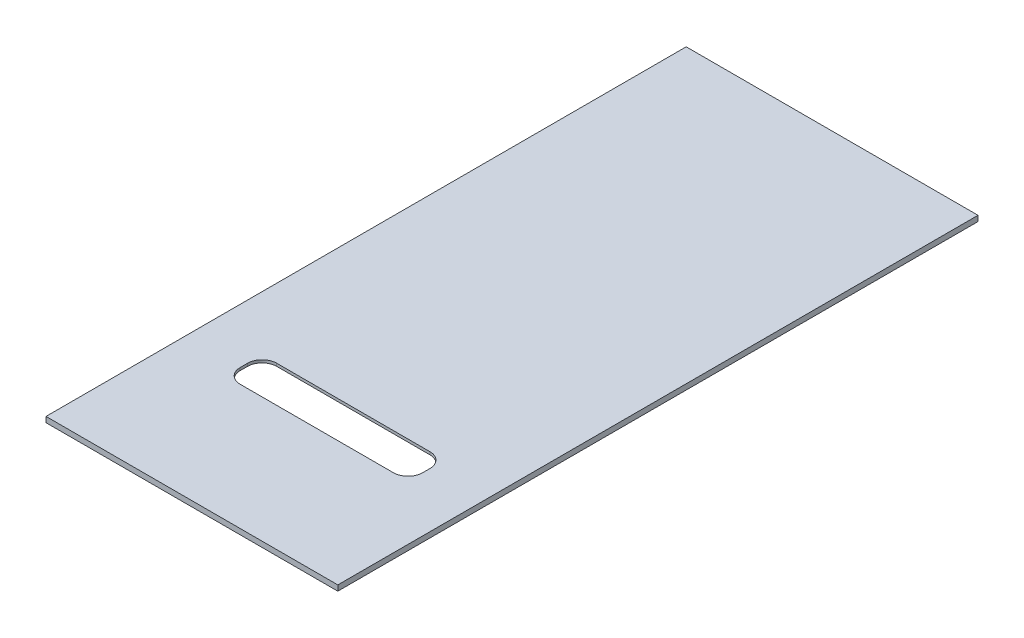
from build123d import *

# Parameters (mm, degrees)
EXTRUDE_1_DEPTH          = 140
EXTRUDE_1_DEPTH_BACK     = 140
EXTRUDE_3_DEPTH          = 35.5
CUT_EXTRUDE_2_REACH      = 197.473
SKETCH_6_W               = 150
SKETCH_6_H               = 80
CUT_EXTRUDE_4_DEPTH      = 6
EXTRUDE_4_DEPTH          = 60.5
CUT_EXTRUDE_START        = -59
CUT_EXTRUDE_6_DEPTH      = 55
CUT_EXTRUDE_START_2      = -4
CUT_EXTRUDE_7_DEPTH      = 27
CUT_EXTRUDE_8_DEPTH      = 35.5
CUT_EXTRUDE_START_3      = -35.5
CUT_EXTRUDE_9_DEPTH      = 35.5
EXTRUDE_5_REACH          = 300.939
SKETCH_25_W              = 121
SKETCH_25_H              = 10
EXTRUDE_6_DEPTH          = 21.5
SKETCH_27_W              = 121
SKETCH_27_H              = 52.5
EXTRUDE_7_DEPTH          = 1.5
SKETCH_28_W              = 121
SKETCH_28_H              = 2
EXTRUDE_8_DEPTH          = 10
CUT_EXTRUDE_11_REACH     = 346.114
SKETCH_29_R              = 2
PATTERN_CIRCULAR_2_COUNT = 10
CUT_EXTRUDE_12_REACH     = 346.114
SKETCH_30_R              = 2
PATTERN_CIRCULAR_3_COUNT = 10
MIRROR_START             = -140
MIRROR_10_OUTLINE_R      = 2
MIRROR_10_DEPTH          = 280
MIRROR_10_2_OUTLINE_R    = 2
MIRROR_10_2_DEPTH        = 4
MIRROR_START_2           = 136
MIRROR_10_3_OUTLINE_R    = 2
MIRROR_10_3_DEPTH        = 4
EXTRUDE_9_REACH          = 263.648
SKETCH_31_W              = 21
SKETCH_31_H              = 16.5
EXTRUDE_10_REACH         = 292.975
SKETCH_34_W              = 121
SKETCH_34_H              = 154
EXTRUDE_11_DEPTH         = 5
EXTRUDE_12_REACH         = 378.928
SKETCH_36_W              = 121
SKETCH_36_H              = 3
EXTRUDE_13_REACH         = 378.928
SKETCH_37_W              = 121
SKETCH_37_H              = 3
SKETCH_38_W              = 100
SKETCH_38_H              = 20
CUT_EXTRUDE_13_DEPTH     = 10
FILLET_1_R               = 8
SKETCH_40_W              = 344.103621996
SKETCH_40_H              = 61.572842363
SKETCH_40_W_2            = 92.051810998
SKETCH_40_H_2            = 3
CUT_EXTRUDE_16_DEPTH     = 399


# Read off the part's stored shape, not the designer's step: 镜向10
with BuildPart() as part:
    # 草图2 → 凸台-拉伸1 (new, two sides: drawn at the far end of the back side and taken through both)
    with BuildSketch(Plane.XY.offset(-EXTRUDE_1_DEPTH_BACK)):
        with BuildLine():
            Line((60.5, 57), (80, 57))
            add(Edge.make_bspline(
                [(80, 57), (110.715171184, 57), (118.023084898, 36.99301361), (125, 20.498008369), (125, 0)],
                knots=[0, 0, 0, 0, 0, 1, 1, 1, 1, 1], degree=4))
            add(Edge.make_bspline(
                [(80, -57), (110.715171184, -57), (118.023084898, -36.99301361), (125, -20.498008369), (125, 0)],
                knots=[0, 0, 0, 0, 0, 1, 1, 1, 1, 1], degree=4))
            Line((80, -57), (60.5, -57))
            Line((60.5, -57), (60.5, -35.5))
            ThreePointArc((60.5, -35.5), (96, 0), (60.5, 35.5))
            Line((60.5, 35.5), (60.5, 57))
        make_face()
    extrude(amount=EXTRUDE_1_DEPTH + EXTRUDE_1_DEPTH_BACK)

    # 草图5 → 凸台-拉伸3 (add)
    with BuildSketch(Plane.XY.offset(140)):
        with BuildLine():
            Line((60.5, -50), (60.5, -57))
            Line((60.5, -57), (80, -57))
            add(Edge.make_bspline(
                [(80, -57), (110.715171184, -57), (118.023084898, -36.99301361), (125, -20.498008369), (125, 0)],
                knots=[0, 0, 0, 0, 0, 1, 1, 1, 1, 1], degree=4))
            add(Edge.make_bspline(
                [(125, 0), (125, 20.498008369), (118.023084898, 36.99301361), (110.715171184, 57), (80, 57)],
                knots=[0, 0, 0, 0, 0, 1, 1, 1, 1, 1], degree=4))
            Line((80, 57), (60.5, 57))
            Line((60.5, 57), (60.5, 50))
            ThreePointArc((60.5, 50), (110.5, 0), (60.5, -50))
        make_face()
    extrude_3 = extrude(amount=EXTRUDE_3_DEPTH)

    # 镜向2: 凸台-拉伸3 across plane
    add(extrude_3.mirror(Plane.XY))

    # 草图6 → 切除-拉伸2 (cut, up to next)
    with BuildSketch(Plane.ZY.offset(-60.5), mode=Mode.PRIVATE) as cut_extrude_2_sk1:
        with Locations((-15, 0)):
            Rectangle(SKETCH_6_W, SKETCH_6_H)
    cut_extrude_2_tool1 = extrude(cut_extrude_2_sk1.sketch, amount=-CUT_EXTRUDE_2_REACH, mode=Mode.PRIVATE) & part.part
    add(cut_extrude_2_tool1.solids().sort_by_distance((60.5, 0, -15))[0], mode=Mode.SUBTRACT)

    # 草图9 → 切除-拉伸4 (cut, symmetric)
    with BuildSketch(Plane(origin=(0, 0, 0), x_dir=(1, 0, 0), z_dir=(0, 1, 0))):
        Polygon((113.429186382, -60), (119.929186382, -60), (119.929186382, -75), (116.929186382, -75), (111.929186382, -69.041232037), (113.429186382, -67.541232037), align=None)
    cut_extrude_4 = extrude(amount=CUT_EXTRUDE_4_DEPTH, both=True, mode=Mode.SUBTRACT)

    # 镜向3: 切除-拉伸4 across plane
    add(cut_extrude_4.mirror(Plane(origin=(0, 0, -15), x_dir=(1, 0, 0), z_dir=(0, 0, -1))), mode=Mode.SUBTRACT)

    # 草图10 → 凸台-拉伸4 (add)
    with BuildSketch(Plane.ZY.offset(-60.5)):
        Polygon((-90, 40), (-90, 35.5), (-92, 35.5), (-92, 42), (62, 42), (62, 35.5), (60, 35.5), (60, 40), align=None)
    extrude(amount=EXTRUDE_4_DEPTH)

    # 草图18 → 切除-拉伸6 (cut)
    with BuildSketch(Plane.XY.offset(140).offset(CUT_EXTRUDE_START)):
        with BuildLine():
            Line((60.5, 54), (60.5, 35.5))
            ThreePointArc((60.5, 35.5), (96, 0), (60.5, -35.5))
            Line((60.5, -35.5), (60.5, -54))
            Line((60.5, -54), (80, -54))
            add(Edge.make_bspline(
                [(80, -54), (84.874930894, -54), (88.983824843, -53.408674679), (94.293485921, -51.914645093), (95.921328006, -51.314644751), (98.940749379, -49.944603182), (100.332473442, -49.174486853), (102.921509382, -47.489185635), (104.118858715, -46.573864409), (106.351651802, -44.617586852), (107.387031345, -43.57654345), (110.285874468, -40.291394559), (111.943828956, -37.885646851), (114.834227827, -32.778060673), (116.065931681, -30.077252128), (118.174928997, -24.486846885), (119.052306998, -21.597764181), (120.481395372, -15.683640995), (121.033233096, -12.658872533), (121.792444122, -6.461288023), (122, -3.288695832), (122, 0)],
                knots=[0, 0, 0, 0, 0.125, 0.125, 0.1875, 0.1875, 0.25, 0.25, 0.3125, 0.3125, 0.375, 0.375, 0.5, 0.5, 0.625, 0.625, 0.75, 0.75, 0.875, 0.875, 1, 1, 1, 1], degree=3))
            add(Edge.make_bspline(
                [(122, 0), (122, 3.288695832), (121.792444122, 6.461288023), (121.033233096, 12.658872533), (120.481395372, 15.683640995), (119.052306998, 21.597764181), (118.174928997, 24.486846885), (116.065931681, 30.077252128), (114.834227827, 32.778060673), (111.943828956, 37.885646851), (110.285874468, 40.291394559), (107.387031345, 43.57654345), (106.351651802, 44.617586852), (104.118858715, 46.573864409), (102.921509382, 47.489185635), (100.332473442, 49.174486853), (98.940749379, 49.944603182), (95.921328006, 51.314644751), (94.293485921, 51.914645093), (88.983824843, 53.408674679), (84.874930894, 54), (80, 54)],
                knots=[0, 0, 0, 0, 0.125, 0.125, 0.25, 0.25, 0.375, 0.375, 0.5, 0.5, 0.625, 0.625, 0.6875, 0.6875, 0.75, 0.75, 0.8125, 0.8125, 0.875, 0.875, 1, 1, 1, 1], degree=3))
            Line((80, 54), (60.5, 54))
        make_face()
    extrude(amount=CUT_EXTRUDE_6_DEPTH, mode=Mode.SUBTRACT)

    # 草图19 → 切除-拉伸7 (cut)
    with BuildSketch(Plane(origin=(0, 0, -140), x_dir=(-1, 0, 0), z_dir=(0, 0, -1)).offset(CUT_EXTRUDE_START_2)):
        with BuildLine():
            Line((-60.5, 54), (-60.5, 35.5))
            ThreePointArc((-60.5, 35.5), (-96, 0), (-60.5, -35.5))
            Line((-60.5, -35.5), (-60.5, -54))
            Line((-60.5, -54), (-80, -54))
            add(Edge.make_bspline(
                [(-80, -54), (-84.874930894, -54), (-88.983824843, -53.408674679), (-94.293485921, -51.914645093), (-95.921328006, -51.314644751), (-98.940749379, -49.944603182), (-100.332473442, -49.174486853), (-102.921509382, -47.489185635), (-104.118858715, -46.573864409), (-106.351651802, -44.617586852), (-107.387031345, -43.57654345), (-110.285874468, -40.291394559), (-111.943828956, -37.885646851), (-114.834227827, -32.778060673), (-116.065931681, -30.077252128), (-118.174928997, -24.486846885), (-119.052306998, -21.597764181), (-120.481395372, -15.683640995), (-121.033233096, -12.658872533), (-121.792444122, -6.461288023), (-122, -3.288695832), (-122, 0)],
                knots=[0, 0, 0, 0, 0.125, 0.125, 0.1875, 0.1875, 0.25, 0.25, 0.3125, 0.3125, 0.375, 0.375, 0.5, 0.5, 0.625, 0.625, 0.75, 0.75, 0.875, 0.875, 1, 1, 1, 1], degree=3))
            add(Edge.make_bspline(
                [(-122, 0), (-122, 3.288695832), (-121.792444122, 6.461288023), (-121.033233096, 12.658872533), (-120.481395372, 15.683640995), (-119.052306998, 21.597764181), (-118.174928997, 24.486846885), (-116.065931681, 30.077252128), (-114.834227827, 32.778060673), (-111.943828956, 37.885646851), (-110.285874468, 40.291394559), (-107.387031345, 43.57654345), (-106.351651802, 44.617586852), (-104.118858715, 46.573864409), (-102.921509382, 47.489185635), (-100.332473442, 49.174486853), (-98.940749379, 49.944603182), (-95.921328006, 51.314644751), (-94.293485921, 51.914645093), (-88.983824843, 53.408674679), (-84.874930894, 54), (-80, 54)],
                knots=[0, 0, 0, 0, 0.125, 0.125, 0.25, 0.25, 0.375, 0.375, 0.5, 0.5, 0.625, 0.625, 0.6875, 0.6875, 0.75, 0.75, 0.8125, 0.8125, 0.875, 0.875, 1, 1, 1, 1], degree=3))
            Line((-80, 54), (-60.5, 54))
        make_face()
    extrude(amount=-CUT_EXTRUDE_7_DEPTH, mode=Mode.SUBTRACT)

    # 草图20 → 切除-拉伸8 (cut)
    with BuildSketch(Plane.XY.offset(175.5)):
        with BuildLine():
            Line((60.5, 54), (60.5, 50))
            ThreePointArc((60.5, 50), (110.5, 0), (60.5, -50))
            Line((60.5, -50), (60.5, -54))
            Line((60.5, -54), (80, -54))
            add(Edge.make_bspline(
                [(80, -54), (84.874930894, -54), (88.983824843, -53.408674679), (94.293485921, -51.914645093), (95.921328006, -51.314644751), (98.940749379, -49.944603182), (100.332473442, -49.174486853), (102.921509382, -47.489185635), (104.118858715, -46.573864409), (106.351651802, -44.617586852), (107.387031345, -43.57654345), (110.285874468, -40.291394559), (111.943828956, -37.885646851), (114.834227827, -32.778060673), (116.065931681, -30.077252128), (118.174928997, -24.486846885), (119.052306998, -21.597764181), (120.481395372, -15.683640995), (121.033233096, -12.658872533), (121.792444122, -6.461288023), (122, -3.288695832), (122, 0)],
                knots=[0, 0, 0, 0, 0.125, 0.125, 0.1875, 0.1875, 0.25, 0.25, 0.3125, 0.3125, 0.375, 0.375, 0.5, 0.5, 0.625, 0.625, 0.75, 0.75, 0.875, 0.875, 1, 1, 1, 1], degree=3))
            add(Edge.make_bspline(
                [(122, 0), (122, 3.288695832), (121.792444122, 6.461288023), (121.033233096, 12.658872533), (120.481395372, 15.683640995), (119.052306998, 21.597764181), (118.174928997, 24.486846885), (116.065931681, 30.077252128), (114.834227827, 32.778060673), (111.943828956, 37.885646851), (110.285874468, 40.291394559), (107.387031345, 43.57654345), (106.351651802, 44.617586852), (104.118858715, 46.573864409), (102.921509382, 47.489185635), (100.332473442, 49.174486853), (98.940749379, 49.944603182), (95.921328006, 51.314644751), (94.293485921, 51.914645093), (88.983824843, 53.408674679), (84.874930894, 54), (80, 54)],
                knots=[0, 0, 0, 0, 0.125, 0.125, 0.25, 0.25, 0.375, 0.375, 0.5, 0.5, 0.625, 0.625, 0.6875, 0.6875, 0.75, 0.75, 0.8125, 0.8125, 0.875, 0.875, 1, 1, 1, 1], degree=3))
            Line((80, 54), (60.5, 54))
        make_face()
    extrude(amount=-CUT_EXTRUDE_8_DEPTH, mode=Mode.SUBTRACT)

    # 草图21 → 切除-拉伸9 (cut)
    with BuildSketch(Plane(origin=(0, 0, -175.5), x_dir=(-1, 0, 0), z_dir=(0, 0, -1)).offset(CUT_EXTRUDE_START_3)):
        with BuildLine():
            Line((-60.5, -50), (-60.5, -54))
            Line((-60.5, -54), (-80, -54))
            add(Edge.make_bspline(
                [(-80, -54), (-84.874930894, -54), (-88.983824843, -53.408674679), (-94.293485921, -51.914645093), (-95.921328006, -51.314644751), (-98.940749379, -49.944603182), (-100.332473442, -49.174486853), (-102.921509382, -47.489185635), (-104.118858715, -46.573864409), (-106.351651802, -44.617586852), (-107.387031345, -43.57654345), (-110.285874468, -40.291394559), (-111.943828956, -37.885646851), (-114.834227827, -32.778060673), (-116.065931681, -30.077252128), (-118.174928997, -24.486846885), (-119.052306998, -21.597764181), (-120.481395372, -15.683640995), (-121.033233096, -12.658872533), (-121.792444122, -6.461288023), (-122, -3.288695832), (-122, 0)],
                knots=[0, 0, 0, 0, 0.125, 0.125, 0.1875, 0.1875, 0.25, 0.25, 0.3125, 0.3125, 0.375, 0.375, 0.5, 0.5, 0.625, 0.625, 0.75, 0.75, 0.875, 0.875, 1, 1, 1, 1], degree=3))
            add(Edge.make_bspline(
                [(-122, 0), (-122, 3.288695832), (-121.792444122, 6.461288023), (-121.033233096, 12.658872533), (-120.481395372, 15.683640995), (-119.052306998, 21.597764181), (-118.174928997, 24.486846885), (-116.065931681, 30.077252128), (-114.834227827, 32.778060673), (-111.943828956, 37.885646851), (-110.285874468, 40.291394559), (-107.387031345, 43.57654345), (-106.351651802, 44.617586852), (-104.118858715, 46.573864409), (-102.921509382, 47.489185635), (-100.332473442, 49.174486853), (-98.940749379, 49.944603182), (-95.921328006, 51.314644751), (-94.293485921, 51.914645093), (-88.983824843, 53.408674679), (-84.874930894, 54), (-80, 54)],
                knots=[0, 0, 0, 0, 0.125, 0.125, 0.25, 0.25, 0.375, 0.375, 0.5, 0.5, 0.625, 0.625, 0.6875, 0.6875, 0.75, 0.75, 0.8125, 0.8125, 0.875, 0.875, 1, 1, 1, 1], degree=3))
            Line((-80, 54), (-60.5, 54))
            Line((-60.5, 54), (-60.5, 50))
            ThreePointArc((-60.5, 50), (-110.5, 0), (-60.5, -50))
        make_face()
    extrude(amount=CUT_EXTRUDE_9_DEPTH, mode=Mode.SUBTRACT)

    # 镜向9: part across plane


with BuildPart() as part_1:
    add(part.part)
    add(part.part.mirror(Plane.ZY))

    # 草图23 → 凸台-拉伸5 (add, up to next)
    with BuildSketch(Plane.XY.offset(-90), mode=Mode.PRIVATE) as extrude_5_sk1:
        with BuildLine():
            Line((-114.034351089, 40), (-110, 40))
            Line((-110, 40), (-110, -40))
            Line((-110, -40), (-114.034351089, -40))
            add(Edge.make_bspline(
                [(-114.034351089, -40), (-119.771865737, -31.446745908), (-122.888445187, -21.34184926), (-125, -11.276676628), (-125, 0)],
                knots=[0.449864766, 0.449864766, 0.449864766, 0.449864766, 0.449864766, 1, 1, 1, 1, 1], degree=4))
            add(Edge.make_bspline(
                [(-125, 0), (-125, 11.276676628), (-122.888445187, 21.34184926), (-119.771865737, 31.446745908), (-114.034351089, 40)],
                knots=[0, 0, 0, 0, 0, 0.550135234, 0.550135234, 0.550135234, 0.550135234, 0.550135234], degree=4))
        make_face()
    extrude_5_tool1 = extrude(extrude_5_sk1.sketch, amount=EXTRUDE_5_REACH, mode=Mode.PRIVATE) - part_1.part
    add(extrude_5_tool1.solids().sort_by_distance((-116.2158, 0, -90))[0])

    # 草图25 → 凸台-拉伸6 (add)
    with BuildSketch(Plane(origin=(0, 57, 0), x_dir=(1, 0, 0), z_dir=(0, 1, 0))):
        with Locations((0, -67)):
            Rectangle(SKETCH_25_W, SKETCH_25_H)
    extrude(amount=-EXTRUDE_6_DEPTH)



with BuildPart() as body_2:
    # 草图27 → 凸台-拉伸7 (new body)
    with BuildSketch(Plane(origin=(0, 57, 0), x_dir=(1, 0, 0), z_dir=(0, 1, 0))):
        with Locations((0, -98.25)):
            Rectangle(SKETCH_27_W, SKETCH_27_H)
    extrude(amount=-EXTRUDE_7_DEPTH)


with BuildPart() as part_2:
    add(part_1.part)

    add(body_2.part)  # 凸台-拉伸8 merges body 2
    # 草图28 → 凸台-拉伸8 (add)
    with BuildSketch(Plane(origin=(0, 57, 0), x_dir=(1, 0, 0), z_dir=(0, 1, 0))):
        with Locations((0, -125.5)):
            Rectangle(SKETCH_28_W, SKETCH_28_H)
    extrude(amount=-EXTRUDE_8_DEPTH)

    # 草图29 → 切除-拉伸11 (cut, up to next)
    with BuildSketch(Plane.XY.offset(140), mode=Mode.PRIVATE) as cut_extrude_11_sk1:
        with Locations((-85.186980596, 33.978713764)):
            Circle(SKETCH_29_R)
    cut_extrude_11_tool1 = extrude(cut_extrude_11_sk1.sketch, amount=-CUT_EXTRUDE_11_REACH, mode=Mode.PRIVATE) & part_2.part
    cut_extrude_11 = cut_extrude_11_tool1.solids().sort_by_distance((-85.186981, 33.978714, 140))[0]
    add(cut_extrude_11, mode=Mode.SUBTRACT)

    # 阵列(圆周)2: 切除-拉伸11 ×10 about axis, 6 skipped
    pattern_circular_2_axis = Axis((-60.5, 0, 140), (0, 0, -1))
    add([cut_extrude_11.rotate(pattern_circular_2_axis, i * 360 / PATTERN_CIRCULAR_2_COUNT) for i in range(1, PATTERN_CIRCULAR_2_COUNT) if i not in (1, 2, 3, 4, 5, 6)], mode=Mode.SUBTRACT)

    # 草图30 → 切除-拉伸12 (cut, up to next)
    with BuildSketch(Plane(origin=(0, 0, -140), x_dir=(-1, 0, 0), z_dir=(0, 0, -1)), mode=Mode.PRIVATE) as cut_extrude_12_sk1:
        with Locations(Location((85.186980596, 33.978713764, 0), (0, 0, 180))):
            Circle(SKETCH_30_R)
    cut_extrude_12_tool1 = extrude(cut_extrude_12_sk1.sketch, amount=-CUT_EXTRUDE_12_REACH, mode=Mode.PRIVATE) & part_2.part
    cut_extrude_12 = cut_extrude_12_tool1.solids().sort_by_distance((-85.186981, 33.978714, -140))[0]
    add(cut_extrude_12, mode=Mode.SUBTRACT)

    # 阵列(圆周)3: 切除-拉伸12 ×10 about axis, 6 skipped
    pattern_circular_3_axis = Axis((-60.5, 0, 140), (0, 0, -1))
    add([cut_extrude_12.rotate(pattern_circular_3_axis, i * 360 / PATTERN_CIRCULAR_3_COUNT) for i in range(1, PATTERN_CIRCULAR_3_COUNT) if i not in (1, 2, 3, 4, 5, 6)], mode=Mode.SUBTRACT)

    # 镜向10 outline → 镜向10 (cut)
    with BuildSketch(Plane.XY.offset(MIRROR_START)):
        with Locations((85.186980596, 33.978713764)):
            Circle(MIRROR_10_OUTLINE_R)
    extrude(amount=MIRROR_10_DEPTH, mode=Mode.SUBTRACT)

    # Mirror 10 2 outline → Mirror 10 2 (cut)
    with BuildSketch(Plane.XY.offset(MIRROR_START)):
        with Locations((100.444373684, 12.978713764)):
            Circle(MIRROR_10_2_OUTLINE_R)
        with Locations((100.444373684, -12.978713764)):
            Circle(MIRROR_10_2_OUTLINE_R)
        with Locations((85.186980596, -33.978713764)):
            Circle(MIRROR_10_2_OUTLINE_R)
    extrude(amount=MIRROR_10_2_DEPTH, mode=Mode.SUBTRACT)

    # Mirror 10 3 outline → Mirror 10 3 (cut)
    with BuildSketch(Plane.XY.offset(MIRROR_START_2)):
        with Locations((100.444373684, 12.978713764)):
            Circle(MIRROR_10_3_OUTLINE_R)
        with Locations((100.444373684, -12.978713764)):
            Circle(MIRROR_10_3_OUTLINE_R)
        with Locations((85.186980596, -33.978713764)):
            Circle(MIRROR_10_3_OUTLINE_R)
    extrude(amount=MIRROR_10_3_DEPTH, mode=Mode.SUBTRACT)

    # 草图31 → 凸台-拉伸9 (add, up to next)
    with BuildSketch(Plane(origin=(-60.5, 0, 0), x_dir=(0, 0, -1), z_dir=(1, 0, 0)), mode=Mode.PRIVATE) as extrude_9_sk1:
        with Locations((-70.5, -43.75)):
            Rectangle(SKETCH_31_W, SKETCH_31_H)
    extrude_9_tool1 = extrude(extrude_9_sk1.sketch, amount=EXTRUDE_9_REACH, mode=Mode.PRIVATE) - part_2.part
    # 草图31 → 凸台-拉伸9 (add, up to next)
    with BuildSketch(Plane(origin=(-60.5, 0, 0), x_dir=(0, 0, -1), z_dir=(1, 0, 0)), mode=Mode.PRIVATE) as extrude_9_sk2:
        Polygon((109, -52), (109, -35.5), (90, -35.5), (90, -40), (90, -52), align=None)
    extrude_9_tool2 = extrude(extrude_9_sk2.sketch, amount=EXTRUDE_9_REACH, mode=Mode.PRIVATE) - part_2.part
    add(extrude_9_tool1.solids().sort_by_distance((-60.5, -43.75, 70.5))[0])
    add(extrude_9_tool2.solids().sort_by_distance((-60.5, -43.75, -99.5))[0])

    # 草图33 → 凸台-拉伸10 (add, up to next)
    with BuildSketch(Plane.XY.offset(81), mode=Mode.PRIVATE) as extrude_10_sk1:
        with BuildLine():
            Line((62.5, 54), (62.5, 35.443617197))
            ThreePointArc((62.5, 35.443617197), (61.500397299, 35.4859015), (60.5, 35.5))
            Line((60.5, 35.5), (60.5, 54))
            Line((60.5, 54), (62.5, 54))
        make_face()
    extrude_10_tool1 = extrude(extrude_10_sk1.sketch, amount=EXTRUDE_10_REACH, mode=Mode.PRIVATE) - part_2.part
    extrude_10 = extrude_10_tool1.solids().sort_by_distance((61.500507, 44.740598, 81))[0]
    add(extrude_10)

    # 镜向11: 凸台-拉伸10 across plane
    add(extrude_10.mirror(Plane(origin=(0, 0, 0), x_dir=(0, 0, 1), z_dir=(1, 0, 0))))

    # 草图34 → 凸台-拉伸11 (add)
    with BuildSketch(Plane(origin=(0, 42, 0), x_dir=(1, 0, 0), z_dir=(0, 1, 0))):
        with Locations((0, 15)):
            Rectangle(SKETCH_34_W, SKETCH_34_H)
    extrude(amount=EXTRUDE_11_DEPTH)

    # 草图36 → 凸台-拉伸12 (add, up to next)
    with BuildSketch(Plane.XY.offset(175.5), mode=Mode.PRIVATE) as extrude_12_sk1:
        with Locations((0, 55.5)):
            Rectangle(SKETCH_36_W, SKETCH_36_H)
    extrude_12_tool1 = extrude(extrude_12_sk1.sketch, amount=-EXTRUDE_12_REACH, mode=Mode.PRIVATE) - part_2.part
    add(extrude_12_tool1.solids().sort_by_distance((0, 55.5, 175.5))[0])

    # 草图37 → 凸台-拉伸13 (add, up to next)
    with BuildSketch(Plane(origin=(0, 0, -175.5), x_dir=(-1, 0, 0), z_dir=(0, 0, -1)), mode=Mode.PRIVATE) as extrude_13_sk1:
        with Locations((0, 55.5)):
            Rectangle(SKETCH_37_W, SKETCH_37_H)
    extrude_13_tool1 = extrude(extrude_13_sk1.sketch, amount=-EXTRUDE_13_REACH, mode=Mode.PRIVATE) - part_2.part
    add(extrude_13_tool1.solids().sort_by_distance((0, 55.5, -175.5))[0])

    # 草图38 → 切除-拉伸13 (cut)
    with BuildSketch(Plane.XZ.offset(-55.5)):
        with Locations((0, 97)):
            Rectangle(SKETCH_38_W, SKETCH_38_H)
    extrude(amount=-CUT_EXTRUDE_13_DEPTH, mode=Mode.SUBTRACT)

    # 圆角1
    fillet_1_edges = [part_2.edges().sort_by_distance(p)[0] for p in [
        (50, 56.25, 107),
        (50, 56.25, 87),
        (-50, 56.25, 87),
        (-50, 56.25, 107),
    ]]
    fillet(fillet_1_edges, radius=FILLET_1_R)

    # 草图40 → 切除-拉伸16 (cut)
    with BuildSketch(Plane(origin=(0, 0, -175.5), x_dir=(-1, 0, 0), z_dir=(0, 0, -1))):
        Polygon((-172.051810998, 54), (-172.051810998, -54), (172.051810998, -54), (172.051810998, 54), (80, 54), (-80, 54), align=None)
        with Locations((0, -84.786421182)):
            Rectangle(SKETCH_40_W, SKETCH_40_H)
        with Locations((-126.025905499, 55.5)):
            Rectangle(SKETCH_40_W_2, SKETCH_40_H_2)
        with Locations((126.025905499, 55.5)):
            Rectangle(SKETCH_40_W_2, SKETCH_40_H_2)
    extrude(amount=-CUT_EXTRUDE_16_DEPTH, mode=Mode.SUBTRACT)


solid = part_2.part
